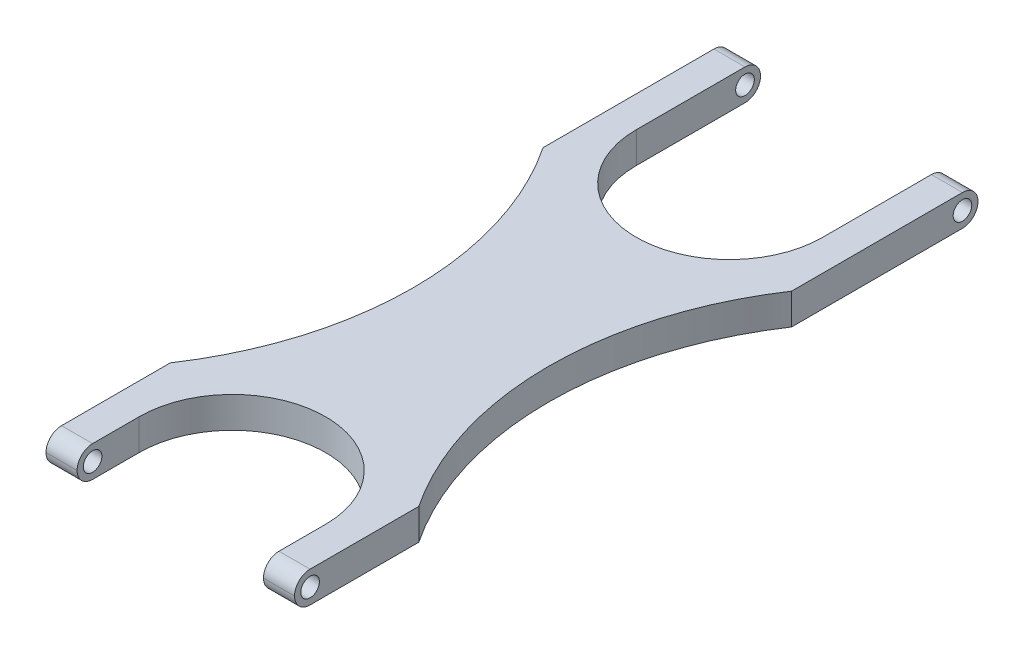
from build123d import *

# Parameters (mm, degrees)
BOSS_EXTRUDE1_DEPTH = 12.7
FILLET1_R           = 6.35
SKETCH2_R           = 3.81
CUT_EXTRUDE1_DEPTH  = 298.570512652
SKETCH3_R           = 3.81
CUT_EXTRUDE2_DEPTH  = 298.570512652


with BuildPart() as part:
    # Sketch1 → Boss-Extrude1 (new body)
    with BuildSketch(Plane(origin=(0, 0, 0), x_dir=(1, 0, 0), z_dir=(0, 1, 0))):
        with BuildLine():
            Line((0, 0), (12.7, 0))
            Line((12.7, 0), (12.7, -50.8))
            ThreePointArc((12.7, -50.8), (23.859231637, -77.740768363), (50.8, -88.9))
            ThreePointArc((50.8, -88.9), (77.740768363, -77.740768363), (88.9, -50.8))
            Line((88.9, -50.8), (88.9, 0))
            Line((88.9, 0), (101.6, 0))
            Line((101.6, 0), (101.6, -76.2))
            ThreePointArc((101.6, -76.2), (78.528496405, -152.4), (101.6, -228.6))
            Line((101.6, -228.6), (101.6, -279.4))
            Line((101.6, -279.4), (88.9, -279.4))
            Line((88.9, -279.4), (88.9, -254))
            ThreePointArc((88.9, -254), (77.740768363, -227.059231637), (50.8, -215.9))
            ThreePointArc((50.8, -215.9), (23.859231637, -227.059231637), (12.7, -254))
            Line((12.7, -254), (12.7, -279.4))
            Line((12.7, -279.4), (0, -279.4))
            Line((0, -279.4), (0, -228.6))
            ThreePointArc((0, -228.6), (23.071503595, -152.4), (0, -76.2))
            Line((0, -76.2), (0, 0))
        make_face()
    extrude(amount=BOSS_EXTRUDE1_DEPTH)

    # Fillet1
    fillet1_edges = [part.edges().sort_by_distance(p)[0] for p in [
        (95.25, 0, 0),
        (6.35, 0, 0),
        (95.25, 12.7, 0),
        (6.35, 12.7, 0),
        (6.35, 0, 279.4),
        (6.35, 12.7, 279.4),
        (95.25, 0, 279.4),
        (95.25, 12.7, 279.4),
    ]]
    fillet(fillet1_edges, radius=FILLET1_R - 0.0001)  # a hair under: the kernel refuses the full size

    # Sketch2 → Cut-Extrude1 (cut, through all)
    with BuildSketch(Plane(origin=(101.6, 0, 0), x_dir=(0, 0, -1), z_dir=(1, 0, 0))):
        with Locations((-273.05, 6.35)):
            Circle(SKETCH2_R)
    extrude(amount=-CUT_EXTRUDE1_DEPTH, mode=Mode.SUBTRACT)

    # Sketch3 → Cut-Extrude2 (cut, through all)
    with BuildSketch(Plane(origin=(101.6, 0, 0), x_dir=(0, 0, -1), z_dir=(1, 0, 0))):
        with Locations((-6.35, 6.35)):
            Circle(SKETCH3_R)
    extrude(amount=-CUT_EXTRUDE2_DEPTH, mode=Mode.SUBTRACT)


solid = part.part
